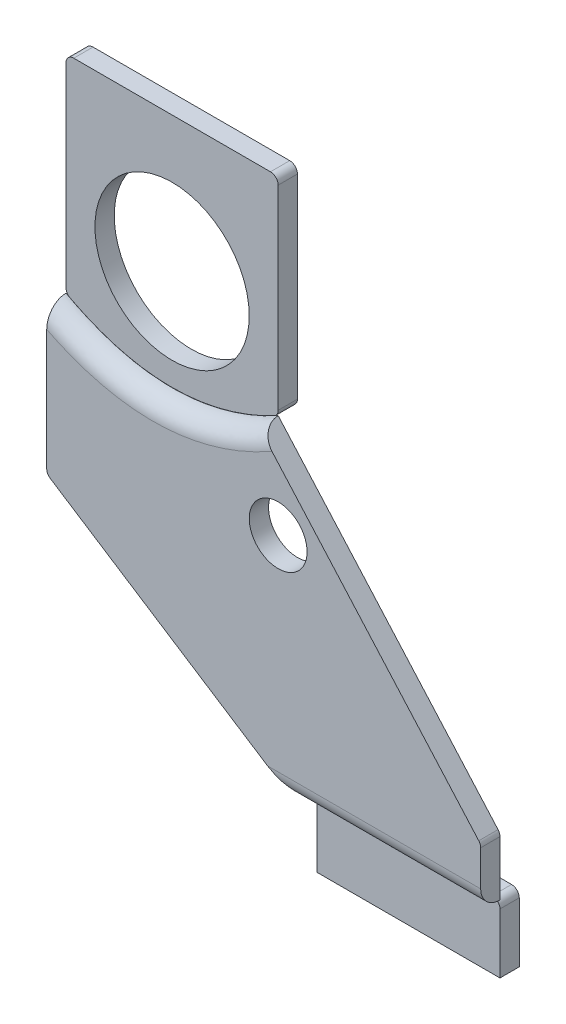
from build123d import *

# Parameters (mm, degrees)
BOSS_EXTRUDE1_DEPTH    = 2
SKETCH25_W             = 19
SKETCH25_H             = 7
BOSS_EXTRUDE14_DEPTH   = 2
BOSS_EXTRUDE14_2_DEPTH = 2
SKETCH26_R             = 8
CUT_EXTRUDE4_DEPTH     = 39.356876892
SKETCH27_R             = 3
CUT_EXTRUDE5_DEPTH     = 39.512984892
FILLET6_R              = 2
FILLET7_R              = 0.8
FILLET8_R              = 0.8
FILLET9_R              = 0.8


with BuildPart() as part:
    # Sketch1 → Boss-Extrude1 (new body)
    with BuildSketch(Plane.XY):
        with BuildLine():
            Line((22.5, -18), (22.5, -24))
            Line((22.5, -24), (3.5, -24))
            Line((3.5, -24), (-22.5, -7.22))
            Line((-22.5, -7.22), (-22.5, 8))
            add(Edge.make_bspline(
                [(-0.5, 8), (-11.5, 2), (-22.5, 8)],
                knots=[0, 0, 0, 1, 1, 1], degree=2))
            Line((-0.5, 8), (22.5, -18))
        make_face()
    extrude(amount=BOSS_EXTRUDE1_DEPTH)

    # Sketch27 → Cut-Extrude5 (cut, through all)
    with BuildSketch(Plane.XY.offset(2)):
        with Locations((1.5, -0.740434783)):
            Circle(SKETCH27_R)
    extrude(amount=-CUT_EXTRUDE5_DEPTH, mode=Mode.SUBTRACT)

    # Fillet6
    fillet6_edges = [part.edges().sort_by_distance(p)[0] for p in [
        (13, -24, 2),
        (-11.5, 5, 2),
    ]]
    fillet(fillet6_edges, radius=FILLET6_R - 0.0001)  # a hair under: the kernel refuses the full size

    # Fillet8
    fillet8_edges = [part.edges().sort_by_distance(p)[0] for p in [
        (22.5, -18, 1),
        (-22.5, -7.22, 1),
    ]]
    fillet(fillet8_edges, radius=FILLET8_R)


with BuildPart() as body_2:
    # Sketch25 → Boss-Extrude14 (new body)
    with BuildSketch(Plane.XY.offset(-2)):
        with Locations((13, -27.5)):
            Rectangle(SKETCH25_W, SKETCH25_H)
    extrude(amount=BOSS_EXTRUDE14_DEPTH)

    # Fillet9
    fillet9_edges = [body_2.edges().sort_by_distance(p)[0] for p in [
        (22.5, -24, -1),
        (3.5, -24, -1),
    ]]
    fillet(fillet9_edges, radius=FILLET9_R)


with BuildPart() as body_3:
    # Sketch25 → Boss-Extrude14 2 (new body)
    with BuildSketch(Plane.XY.offset(-2)):
        with BuildLine():
            Line((-22.5, 8), (-22.5, 29.5))
            Line((-22.5, 29.5), (-0.5, 29.5))
            Line((-0.5, 29.5), (-0.5, 8))
            add(Edge.make_bspline(
                [(-22.5, 8), (-11.5, 2.054280429), (-0.5, 8)],
                knots=[0, 0, 0, 1, 1, 1], degree=2))
        make_face()
    extrude(amount=BOSS_EXTRUDE14_2_DEPTH)

    # Sketch26 → Cut-Extrude4 (cut, through all)
    with BuildSketch(Plane.XY):
        with Locations((-11.5, 15.463373966)):
            Circle(SKETCH26_R)
    extrude(amount=-CUT_EXTRUDE4_DEPTH, mode=Mode.SUBTRACT)

    # Fillet7
    fillet7_edges = [body_3.edges().sort_by_distance(p)[0] for p in [
        (-0.5, 8, -1),
        (-22.5, 8, -1),
        (-0.5, 29.5, -1),
        (-22.5, 29.5, -1),
    ]]
    fillet(fillet7_edges, radius=FILLET7_R)


solid = Compound([part.part, body_2.part, body_3.part])
